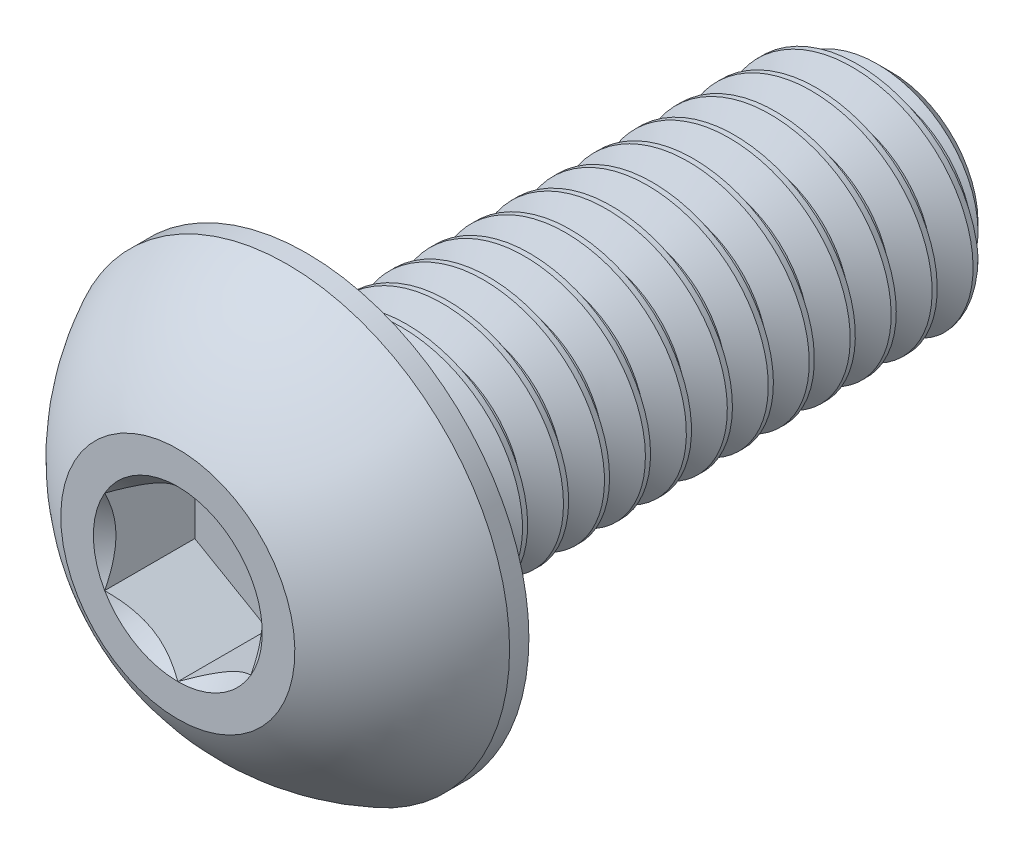
from build123d import *

# Parameters (mm, degrees)
CUT_EXTRUDE2_DEPTH = 1.54
CUT_SWEEP2_PITCH   = 0.7


# Read off the part's stored shape, not the designer's step: Split1, Boss-Extrude1
with BuildPart() as part:
    # Sketch10 → Revolve3 (revolve)
    with BuildSketch(Plane(origin=(0, 0, 0), x_dir=(0, 0, -1), z_dir=(1, 0, 0)), mode=Mode.PRIVATE) as revolve3_sk:
        Polygon((11.675, 2), (12.2, 1.475), (12.2, 0), (2.2, 0), (2.2, 2), align=None)
    revolve(revolve3_sk.sketch.rotate(Axis((0, 0, 0), (0, 0, -1)), 90), axis=Axis((0, 0, 0), (0, 0, -1)))

    # Sketch7 → Revolve2 (revolve)
    with BuildSketch(Plane(origin=(0, 0, 0), x_dir=(0, 0, -1), z_dir=(1, 0, 0)), mode=Mode.PRIVATE) as revolve2_sk:
        with BuildLine():
            Line((1.87, 3.8), (2.2, 3.8))
            Line((2.2, 3.8), (2.2, 0))
            Line((2.2, 0), (0, 0))
            Line((0, 0), (0, 2))
            ThreePointArc((0, 2), (0.793500147, 3.047002626), (1.87, 3.8))
        make_face()
    revolve(revolve2_sk.sketch.rotate(Axis((0, 0, 0), (0, 0, -1)), 180), axis=Axis((0, 0, 0), (0, 0, -1)))

    # Sketch5 → Cut-Extrude2 (cut)
    with BuildSketch(Plane.XY):
        Polygon((1.25, -0.721687836), (1.25, 0.721687836), (0, 1.443375673), (-1.25, 0.721687836), (-1.25, -0.721687836), (0, -1.443375673), align=None)
    extrude(amount=-CUT_EXTRUDE2_DEPTH, mode=Mode.SUBTRACT)

    # Cut-Extrude3 cone 1 section (through the dimple's axis) → Cut-Extrude3 (revolve, cut)
    with BuildSketch(Plane(origin=(0, 0, 0), x_dir=(0, -1, 0), z_dir=(1, 0, 0))):
        Polygon((0, 0), (1.443375673, 0), (0, 1.443375673), align=None)
    revolve(axis=Axis((0, 0, 0), (0, 0, -1)), mode=Mode.SUBTRACT)


with BuildPart() as body_2:
    # Split1: the piece on the far side of the plane
    add(part.part)
    split(bisect_by=Plane.XY.offset(-2.2), keep=Keep.BOTTOM)

    # Cut-Sweep2: the profile of Sketch12 screwed along a right-hand helix of 17.428571 turns, 6 arcs to a turn; built about Z, then put on its axis
    cut_sweep2_z = Axis((0, 0, 0), (0, 0, 1))
    cut_sweep2_corners = [(1.545336663, 0, -0.2625), (1.545336663, 0, -0.35), (2.037888611, 0, -0.634375), (2.037888611, 0, 0.021875)]
    with BuildLine(mode=Mode.PRIVATE) as cut_sweep2_profile:
        Line(cut_sweep2_corners[0], cut_sweep2_corners[1])
        Line(cut_sweep2_corners[1], cut_sweep2_corners[2])
        Line(cut_sweep2_corners[2], cut_sweep2_corners[3])
        Line(cut_sweep2_corners[3], cut_sweep2_corners[0])
    cut_sweep2_cap = Face(cut_sweep2_profile.wire())
    cut_sweep2_turn_angles = [0, 30, 60, 90, 120, 150, 180, 210, 240, 270, 300, 330, 360]
    cut_sweep2_turn_weights = [1, 0.8660254037844387, 1, 0.8660254037844387, 1, 0.8660254037844387, 1, 0.8660254037844387, 1, 0.8660254037844387, 1, 0.8660254037844387, 1]
    cut_sweep2_turn_rails = [Edge.make_bspline([Vector(p[0], p[1], 0).rotate(cut_sweep2_z, cut_sweep2_turn_angles[k]) / cut_sweep2_turn_weights[k] + Vector(0, 0, p[2] + CUT_SWEEP2_PITCH * cut_sweep2_turn_angles[k] / 360) for k in range(13)], [0, 0, 0, 1, 1, 2, 2, 3, 3, 4, 4, 5, 5, 6, 6, 6], 2, cut_sweep2_turn_weights) for p in cut_sweep2_corners]
    cut_sweep2_turn_sides = [Face.make_surface_from_curves(cut_sweep2_turn_rails[p[0]], cut_sweep2_turn_rails[p[1]]) for p in [(0, 1), (1, 2), (2, 3), (3, 0)]]
    cut_sweep2_turn = Solid(Shell([*cut_sweep2_turn_sides, cut_sweep2_cap, cut_sweep2_cap.rotate(cut_sweep2_z, 360).moved(Location((0, 0, CUT_SWEEP2_PITCH * 360 / 360)))]))
    cut_sweep2_last_angles = [6120, 6150, 6180, 6210, 6240, 6257.142857143, 6274.285714286]
    cut_sweep2_last_weights = [1, 0.8660254037844387, 1, 0.8660254037844387, 1, 0.9555728057862964, 1]
    cut_sweep2_last_rails = [Edge.make_bspline([Vector(p[0], p[1], 0).rotate(cut_sweep2_z, cut_sweep2_last_angles[k]) / cut_sweep2_last_weights[k] + Vector(0, 0, p[2] + CUT_SWEEP2_PITCH * cut_sweep2_last_angles[k] / 360) for k in range(7)], [0, 0, 0, 1, 1, 2, 2, 3, 3, 3], 2, cut_sweep2_last_weights) for p in cut_sweep2_corners]
    cut_sweep2_last_sides = [Face.make_surface_from_curves(cut_sweep2_last_rails[p[0]], cut_sweep2_last_rails[p[1]]) for p in [(0, 1), (1, 2), (2, 3), (3, 0)]]
    cut_sweep2_last = Solid(Shell([*cut_sweep2_last_sides, cut_sweep2_cap.rotate(cut_sweep2_z, 6120).moved(Location((0, 0, CUT_SWEEP2_PITCH * 6120 / 360))), cut_sweep2_cap.rotate(cut_sweep2_z, 6274.285714286).moved(Location((0, 0, CUT_SWEEP2_PITCH * 6274.285714286 / 360)))]))
    cut_sweep2_each = [*[cut_sweep2_turn.moved(Location((0, 0, CUT_SWEEP2_PITCH * i))) for i in range(17)], cut_sweep2_last]
    add(Plane(origin=(0, 0, -12.2), x_dir=(0, 1, 0), z_dir=(0, 0, 1)) * Compound([cut_sweep2_each[i] for i in range(0, 18, 2)]), mode=Mode.SUBTRACT)
    add(Plane(origin=(0, 0, -12.2), x_dir=(0, 1, 0), z_dir=(0, 0, 1)) * Compound([cut_sweep2_each[i] for i in range(1, 18, 2)]), mode=Mode.SUBTRACT)


with BuildPart() as part_1:
    add(part.part)

    # Split1
    split(bisect_by=Plane.XY.offset(-2.2), keep=Keep.TOP)

    add(body_2.part)  # Boss-Extrude1 merges body 2
    # Boss-Extrude1 outline → Boss-Extrude1 (revolve)
    with BuildSketch(Plane.XZ):
        Polygon((1.545336663, -2.2), (1.545336663, -2.654663337), (2, -2.2), align=None)
    revolve(axis=Axis((0, 0, 0), (0, 0, 1)))


solid = part_1.part
